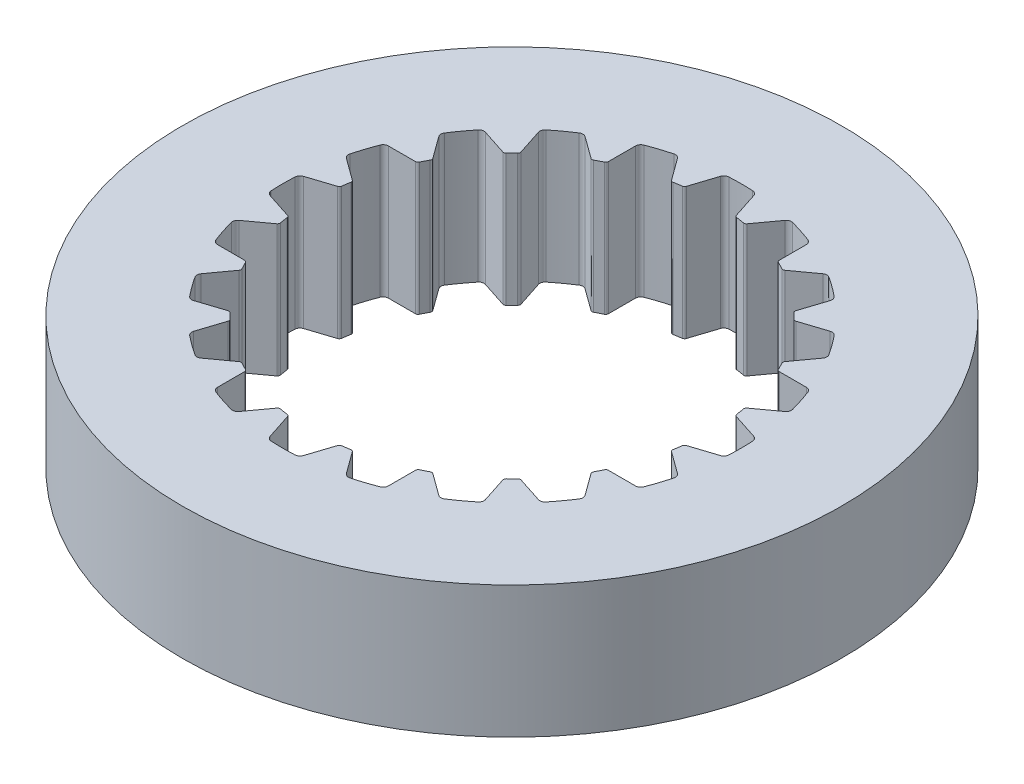
from build123d import *

# Parameters (mm, degrees)
SKETCH1_R                = 15.875
SKETCH1_R_2              = 11.0363
SKETCH1_R_3              = 9.60755
BOSS_EXTRUDE2_DEPTH      = 6.35
SKETCH1_4_R              = 9.60755
CUT_EXTRUDE3_DEPTH       = 6.35
FILLET1_R                = 0.254
CIRPATTERN1_COUNT        = 20
FILLET1_OF_CIRPATTERN1_R = 0.254
FILLET2_R                = 0.127
CIRPATTERN3_DEPTH        = 6.35


# Read off the part's stored shape, not the designer's step: CirPattern3
with BuildPart() as part:
    # Sketch1 → Boss-Extrude2 (new body)
    # profile 1 of 6: a face of its own
    with BuildSketch(Plane(origin=(0, 0, 0), x_dir=(1, 0, 0), z_dir=(0, 1, 0))):
        with Locations(Location((0, 0, 0), (0, 0, 270))):
            Circle(SKETCH1_R)
        Circle(SKETCH1_R_2, mode=Mode.SUBTRACT)
    # profile 2 of 6: a face of its own
    with BuildSketch(Plane(origin=(0, 0, 0), x_dir=(1, 0, 0), z_dir=(0, 1, 0))):
        with BuildLine():
            ThreePointArc((9.60755, 0), (-6.343085848, -7.215973872), (-1.2319, 9.528244297))
            Line((-1.2319, 9.528244297), (-1.043754312, 10.106244453))
            Line((-1.043754312, 10.106244453), (-0.7493, 11.010834083))
            ThreePointArc((-0.7493, 11.010834083), (-7.534268979, -8.064409999), (11.0363, 0))
            ThreePointArc((11.0363, 0), (8.064409999, 7.534268979), (0.7493, 11.010834083))
            Line((0.7493, 11.010834083), (1.043754312, 10.106244453))
            Line((1.043754312, 10.106244453), (1.2319, 9.528244297))
            ThreePointArc((1.2319, 9.528244297), (7.215973872, 6.343085848), (9.60755, 0))
        make_face()
    # profile 3 of 6: a face of its own
    with BuildSketch(Plane(origin=(0, 0, 0), x_dir=(1, 0, 0), z_dir=(0, 1, 0))):
        Circle(SKETCH1_R_3)
    # profile 4 of 6: a face of its own
    with BuildSketch(Plane(origin=(0, 0, 0), x_dir=(1, 0, 0), z_dir=(0, 1, 0))):
        with BuildLine():
            Line((-1.043754312, 10.106244453), (-1.2319, 9.528244297))
            ThreePointArc((-1.2319, 9.528244297), (0, 9.60755), (1.2319, 9.528244297))
            Line((1.2319, 9.528244297), (1.043754312, 10.106244453))
            Line((1.043754312, 10.106244453), (0.7366, 11.011690975))
            ThreePointArc((0.7366, 11.011690975), (0, 11.0363), (-0.7366, 11.011690975))
            Line((-0.7366, 11.011690975), (-1.043754312, 10.106244453))
        make_face()
    # profile 5 of 6: a face of its own
    with BuildSketch(Plane(origin=(0, 0, 0), x_dir=(1, 0, 0), z_dir=(0, 1, 0))):
        with BuildLine():
            Line((0.7366, 11.011690975), (1.043754312, 10.106244453))
            Line((1.043754312, 10.106244453), (0.7493, 11.010834083))
            ThreePointArc((0.7493, 11.010834083), (0.742950124, 11.01126436), (0.7366, 11.011690975))
        make_face()
    # profile 6 of 6: a face of its own
    with BuildSketch(Plane(origin=(0, 0, 0), x_dir=(1, 0, 0), z_dir=(0, 1, 0))):
        with BuildLine():
            Line((-0.7493, 11.010834083), (-1.043754312, 10.106244453))
            Line((-1.043754312, 10.106244453), (-0.7366, 11.011690975))
            ThreePointArc((-0.7366, 11.011690975), (-0.742950124, 11.01126436), (-0.7493, 11.010834083))
        make_face()
    extrude(amount=BOSS_EXTRUDE2_DEPTH)

    # Sketch1<4> → Cut-Extrude3 (cut)
    with BuildSketch(Plane(origin=(0, 0, 0), x_dir=(1, 0, 0), z_dir=(0, 1, 0))):
        Circle(SKETCH1_4_R)
        with BuildLine():
            Line((-0.7493, 11.010834083), (-1.2319, 9.528244297))
            ThreePointArc((-1.2319, 9.528244297), (0, 9.60755), (1.2319, 9.528244297))
            Line((1.2319, 9.528244297), (0.7493, 11.010834083))
            ThreePointArc((0.7493, 11.010834083), (0, 11.0363), (-0.7493, 11.010834083))
        make_face()
    cut_extrude3 = extrude(amount=CUT_EXTRUDE3_DEPTH, mode=Mode.SUBTRACT)

    # Fillet1
    fillet1_edges = [part.edges().sort_by_distance(p)[0] for p in [
        (0.7493, 3.175, -11.010834083),
        (-0.7493, 3.175, -11.010834083),
    ]]
    fillet(fillet1_edges, radius=FILLET1_R)

    # CirPattern1: Cut-Extrude3 ×20 about axis
    cirpattern1_axis = Axis((0, 0, 0), (0, 1, 0))
    for i in range(1, CIRPATTERN1_COUNT):
        add(cut_extrude3.rotate(cirpattern1_axis, i * 360 / CIRPATTERN1_COUNT), mode=Mode.SUBTRACT)

    # Fillet1 of CirPattern1
    fillet1_of_cirpattern1_edges = [part.edges().sort_by_distance(p)[0] for p in [
        (-2.689908206, 3.175, -10.703471938),
        (-4.115161502, 3.175, -10.24037907),
        (-5.865809455, 3.175, -9.348379385),
        (-7.078202323, 3.175, -8.467524406),
        (-8.467524406, 3.175, -7.078202323),
        (-9.348379385, 3.175, -5.865809455),
        (-10.24037907, 3.175, -4.115161502),
        (-10.703471938, 3.175, -2.689908206),
        (-11.010834083, 3.175, -0.7493),
        (-11.010834083, 3.175, 0.7493),
        (-10.703471938, 3.175, 2.689908206),
        (-10.24037907, 3.175, 4.115161502),
        (-9.348379385, 3.175, 5.865809455),
        (-8.467524406, 3.175, 7.078202323),
        (-7.078202323, 3.175, 8.467524406),
        (-5.865809455, 3.175, 9.348379385),
        (-4.115161502, 3.175, 10.24037907),
        (-2.689908206, 3.175, 10.703471938),
        (-0.7493, 3.175, 11.010834083),
        (0.7493, 3.175, 11.010834083),
        (2.689908206, 3.175, 10.703471938),
        (4.115161502, 3.175, 10.24037907),
        (5.865809455, 3.175, 9.348379385),
        (7.078202323, 3.175, 8.467524406),
        (8.467524406, 3.175, 7.078202323),
        (9.348379385, 3.175, 5.865809455),
        (10.24037907, 3.175, 4.115161502),
        (10.703471938, 3.175, 2.689908206),
        (11.010834083, 3.175, 0.7493),
        (11.010834083, 3.175, -0.7493),
        (10.703471938, 3.175, -2.689908206),
        (10.24037907, 3.175, -4.115161502),
        (9.348379385, 3.175, -5.865809455),
        (8.467524406, 3.175, -7.078202323),
        (7.078202323, 3.175, -8.467524406),
        (5.865809455, 3.175, -9.348379385),
        (4.115161502, 3.175, -10.24037907),
        (2.689908206, 3.175, -10.703471938),
    ]]
    fillet(fillet1_of_cirpattern1_edges, radius=FILLET1_OF_CIRPATTERN1_R)

    # Fillet2
    fillet2_edges = [part.edges().sort_by_distance(p)[0] for p in [
        (-1.772782892, 3.175, -9.442576863),
        (-1.2319, 3.175, -9.528244297),
    ]]
    fillet(fillet2_edges, radius=FILLET2_R)

    # CirPattern3 outline → CirPattern3 (cut)
    with BuildSketch(Plane(origin=(0, 0, 0), x_dir=(1, 0, 0), z_dir=(0, 1, 0))):
        with BuildLine():
            ThreePointArc((4.115995937, 8.681220793), (4.151832536, 8.664138942), (4.187598245, 8.646909155))
            ThreePointArc((4.187598245, 8.646909155), (4.135362945, 8.693732158), (4.115953164, 8.761142696))
            Line((4.115953164, 8.761142696), (4.115995937, 8.681220793))
        make_face()
        with BuildLine():
            ThreePointArc((4.668616762, 8.479546528), (4.602671709, 8.455626451), (4.534087965, 8.470363825))
            ThreePointArc((4.534087965, 8.470363825), (4.569049711, 8.451556173), (4.603933443, 8.432604216))
            Line((4.603933443, 8.432604216), (4.668616762, 8.479546528))
        make_face()
        with BuildLine():
            ThreePointArc((-4.603933443, 8.432604216), (-4.569049711, 8.451556173), (-4.534087965, 8.470363825))
            ThreePointArc((-4.534087965, 8.470363825), (-4.602671709, 8.455626451), (-4.668616762, 8.479546528))
            Line((-4.668616762, 8.479546528), (-4.603933443, 8.432604216))
        make_face()
        with BuildLine():
            ThreePointArc((-4.115953164, 8.761142696), (-4.135362945, 8.693732158), (-4.187598245, 8.646909155))
            ThreePointArc((-4.187598245, 8.646909155), (-4.151832536, 8.664138942), (-4.115995937, 8.681220793))
            Line((-4.115995937, 8.681220793), (-4.115953164, 8.761142696))
        make_face()
        with BuildLine():
            ThreePointArc((-1.2319, -9.528244297), (-1.271261214, -9.523072609), (-1.310600721, -9.517738321))
            ThreePointArc((-1.310600721, -9.517738321), (-1.246452895, -9.546128048), (-1.207162094, -9.604241327))
            Line((-1.207162094, -9.604241327), (-1.2319, -9.528244297))
        make_face()
        with BuildLine():
            ThreePointArc((-1.819794412, -9.5072099), (-1.76446865, -9.464082413), (-1.694687534, -9.456904946))
            ThreePointArc((-1.694687534, -9.456904946), (-1.733750014, -9.44982158), (-1.772782892, -9.442576863))
            Line((-1.772782892, -9.442576863), (-1.819794412, -9.5072099))
        make_face()
        with BuildLine():
            ThreePointArc((-4.115995937, -8.681220793), (-4.151832536, -8.664138942), (-4.187598245, -8.646909155))
            ThreePointArc((-4.187598245, -8.646909155), (-4.135362945, -8.693732158), (-4.115953164, -8.761142696))
            Line((-4.115953164, -8.761142696), (-4.115995937, -8.681220793))
        make_face()
        with BuildLine():
            ThreePointArc((-4.668616762, -8.479546528), (-4.602671709, -8.455626451), (-4.534087965, -8.470363825))
            ThreePointArc((-4.534087965, -8.470363825), (-4.569049711, -8.451556173), (-4.603933443, -8.432604216))
            Line((-4.603933443, -8.432604216), (-4.668616762, -8.479546528))
        make_face()
        with BuildLine():
            ThreePointArc((-8.432604216, -4.603933443), (-8.451556173, -4.569049711), (-8.470363825, -4.534087965))
            ThreePointArc((-8.470363825, -4.534087965), (-8.455626451, -4.602671709), (-8.479546528, -4.668616762))
            Line((-8.479546528, -4.668616762), (-8.432604216, -4.603933443))
        make_face()
        with BuildLine():
            ThreePointArc((-8.761142696, -4.115953164), (-8.693732158, -4.135362945), (-8.646909155, -4.187598245))
            ThreePointArc((-8.646909155, -4.187598245), (-8.664138942, -4.151832536), (-8.681220793, -4.115995937))
            Line((-8.681220793, -4.115995937), (-8.761142696, -4.115953164))
        make_face()
        with BuildLine():
            ThreePointArc((-6.597189514, -6.984418911), (-6.625993563, -6.957098987), (-6.654684476, -6.929660275))
            ThreePointArc((-6.654684476, -6.929660275), (-6.619474858, -6.990333193), (-6.621846061, -7.060442376))
            Line((-6.621846061, -7.060442376), (-6.597189514, -6.984418911))
        make_face()
        with BuildLine():
            ThreePointArc((-7.060442376, -6.621846061), (-6.990333193, -6.619474858), (-6.929660275, -6.654684476))
            ThreePointArc((-6.929660275, -6.654684476), (-6.957098987, -6.625993563), (-6.984418911, -6.597189514))
            Line((-6.984418911, -6.597189514), (-7.060442376, -6.621846061))
        make_face()
        with BuildLine():
            ThreePointArc((-8.681220793, 4.115995937), (-8.664138942, 4.151832536), (-8.646909155, 4.187598245))
            ThreePointArc((-8.646909155, 4.187598245), (-8.693732158, 4.135362945), (-8.761142696, 4.115953164))
            Line((-8.761142696, 4.115953164), (-8.681220793, 4.115995937))
        make_face()
        with BuildLine():
            ThreePointArc((-8.479546528, 4.668616762), (-8.455626451, 4.602671709), (-8.470363825, 4.534087965))
            ThreePointArc((-8.470363825, 4.534087965), (-8.451556173, 4.569049711), (-8.432604216, 4.603933443))
            Line((-8.432604216, 4.603933443), (-8.479546528, 4.668616762))
        make_face()
        with BuildLine():
            ThreePointArc((-6.984418911, 6.597189514), (-6.957098987, 6.625993563), (-6.929660275, 6.654684476))
            ThreePointArc((-6.929660275, 6.654684476), (-6.990333193, 6.619474858), (-7.060442376, 6.621846061))
            Line((-7.060442376, 6.621846061), (-6.984418911, 6.597189514))
        make_face()
        with BuildLine():
            ThreePointArc((-6.621846061, 7.060442376), (-6.619474858, 6.990333193), (-6.654684476, 6.929660275))
            ThreePointArc((-6.654684476, 6.929660275), (-6.625993563, 6.957098987), (-6.597189514, 6.984418911))
            Line((-6.597189514, 6.984418911), (-6.621846061, 7.060442376))
        make_face()
        with BuildLine():
            ThreePointArc((-9.528244297, 1.2319), (-9.523072609, 1.271261214), (-9.517738321, 1.310600721))
            ThreePointArc((-9.517738321, 1.310600721), (-9.546128048, 1.246452895), (-9.604241327, 1.207162094))
            Line((-9.604241327, 1.207162094), (-9.528244297, 1.2319))
        make_face()
        with BuildLine():
            ThreePointArc((-9.5072099, 1.819794412), (-9.464082413, 1.76446865), (-9.456904946, 1.694687534))
            ThreePointArc((-9.456904946, 1.694687534), (-9.44982158, 1.733750014), (-9.442576863, 1.772782892))
            Line((-9.442576863, 1.772782892), (-9.5072099, 1.819794412))
        make_face()
        with BuildLine():
            ThreePointArc((-9.442576863, -1.772782892), (-9.44982158, -1.733750014), (-9.456904946, -1.694687534))
            ThreePointArc((-9.456904946, -1.694687534), (-9.464082413, -1.76446865), (-9.5072099, -1.819794412))
            Line((-9.5072099, -1.819794412), (-9.442576863, -1.772782892))
        make_face()
        with BuildLine():
            ThreePointArc((-9.604241327, -1.207162094), (-9.546128048, -1.246452895), (-9.517738321, -1.310600721))
            ThreePointArc((-9.517738321, -1.310600721), (-9.523072609, -1.271261214), (-9.528244297, -1.2319))
            Line((-9.528244297, -1.2319), (-9.604241327, -1.207162094))
        make_face()
        with BuildLine():
            ThreePointArc((8.681220793, -4.115995937), (8.664138942, -4.151832536), (8.646909155, -4.187598245))
            ThreePointArc((8.646909155, -4.187598245), (8.693732158, -4.135362945), (8.761142696, -4.115953164))
            Line((8.761142696, -4.115953164), (8.681220793, -4.115995937))
        make_face()
        with BuildLine():
            ThreePointArc((8.479546528, -4.668616762), (8.455626451, -4.602671709), (8.470363825, -4.534087965))
            ThreePointArc((8.470363825, -4.534087965), (8.451556173, -4.569049711), (8.432604216, -4.603933443))
            Line((8.432604216, -4.603933443), (8.479546528, -4.668616762))
        make_face()
        with BuildLine():
            ThreePointArc((6.984418911, -6.597189514), (6.957098987, -6.625993563), (6.929660275, -6.654684476))
            ThreePointArc((6.929660275, -6.654684476), (6.990333193, -6.619474858), (7.060442376, -6.621846061))
            Line((7.060442376, -6.621846061), (6.984418911, -6.597189514))
        make_face()
        with BuildLine():
            ThreePointArc((6.621846061, -7.060442376), (6.619474858, -6.990333193), (6.654684476, -6.929660275))
            ThreePointArc((6.654684476, -6.929660275), (6.625993563, -6.957098987), (6.597189514, -6.984418911))
            Line((6.597189514, -6.984418911), (6.621846061, -7.060442376))
        make_face()
        with BuildLine():
            ThreePointArc((1.772782892, -9.442576863), (1.733750014, -9.44982158), (1.694687534, -9.456904946))
            ThreePointArc((1.694687534, -9.456904946), (1.76446865, -9.464082413), (1.819794412, -9.5072099))
            Line((1.819794412, -9.5072099), (1.772782892, -9.442576863))
        make_face()
        with BuildLine():
            ThreePointArc((1.207162094, -9.604241327), (1.246452895, -9.546128048), (1.310600721, -9.517738321))
            ThreePointArc((1.310600721, -9.517738321), (1.271261214, -9.523072609), (1.2319, -9.528244297))
            Line((1.2319, -9.528244297), (1.207162094, -9.604241327))
        make_face()
        with BuildLine():
            ThreePointArc((4.603933443, -8.432604216), (4.569049711, -8.451556173), (4.534087965, -8.470363825))
            ThreePointArc((4.534087965, -8.470363825), (4.602671709, -8.455626451), (4.668616762, -8.479546528))
            Line((4.668616762, -8.479546528), (4.603933443, -8.432604216))
        make_face()
        with BuildLine():
            ThreePointArc((4.115953164, -8.761142696), (4.135362945, -8.693732158), (4.187598245, -8.646909155))
            ThreePointArc((4.187598245, -8.646909155), (4.151832536, -8.664138942), (4.115995937, -8.681220793))
            Line((4.115995937, -8.681220793), (4.115953164, -8.761142696))
        make_face()
        with BuildLine():
            ThreePointArc((9.442576863, 1.772782892), (9.44982158, 1.733750014), (9.456904946, 1.694687534))
            ThreePointArc((9.456904946, 1.694687534), (9.464082413, 1.76446865), (9.5072099, 1.819794412))
            Line((9.5072099, 1.819794412), (9.442576863, 1.772782892))
        make_face()
        with BuildLine():
            ThreePointArc((9.604241327, 1.207162094), (9.546128048, 1.246452895), (9.517738321, 1.310600721))
            ThreePointArc((9.517738321, 1.310600721), (9.523072609, 1.271261214), (9.528244297, 1.2319))
            Line((9.528244297, 1.2319), (9.604241327, 1.207162094))
        make_face()
        with BuildLine():
            ThreePointArc((9.528244297, -1.2319), (9.523072609, -1.271261214), (9.517738321, -1.310600721))
            ThreePointArc((9.517738321, -1.310600721), (9.546128048, -1.246452895), (9.604241327, -1.207162094))
            Line((9.604241327, -1.207162094), (9.528244297, -1.2319))
        make_face()
        with BuildLine():
            ThreePointArc((9.5072099, -1.819794412), (9.464082413, -1.76446865), (9.456904946, -1.694687534))
            ThreePointArc((9.456904946, -1.694687534), (9.44982158, -1.733750014), (9.442576863, -1.772782892))
            Line((9.442576863, -1.772782892), (9.5072099, -1.819794412))
        make_face()
        with BuildLine():
            ThreePointArc((8.432604216, 4.603933443), (8.451556173, 4.569049711), (8.470363825, 4.534087965))
            ThreePointArc((8.470363825, 4.534087965), (8.455626451, 4.602671709), (8.479546528, 4.668616762))
            Line((8.479546528, 4.668616762), (8.432604216, 4.603933443))
        make_face()
        with BuildLine():
            ThreePointArc((8.761142696, 4.115953164), (8.693732158, 4.135362945), (8.646909155, 4.187598245))
            ThreePointArc((8.646909155, 4.187598245), (8.664138942, 4.151832536), (8.681220793, 4.115995937))
            Line((8.681220793, 4.115995937), (8.761142696, 4.115953164))
        make_face()
        with BuildLine():
            ThreePointArc((6.597189514, 6.984418911), (6.625993563, 6.957098987), (6.654684476, 6.929660275))
            ThreePointArc((6.654684476, 6.929660275), (6.619474858, 6.990333193), (6.621846061, 7.060442376))
            Line((6.621846061, 7.060442376), (6.597189514, 6.984418911))
        make_face()
        with BuildLine():
            ThreePointArc((7.060442376, 6.621846061), (6.990333193, 6.619474858), (6.929660275, 6.654684476))
            ThreePointArc((6.929660275, 6.654684476), (6.957098987, 6.625993563), (6.984418911, 6.597189514))
            Line((6.984418911, 6.597189514), (7.060442376, 6.621846061))
        make_face()
        with BuildLine():
            ThreePointArc((1.2319, 9.528244297), (1.271261214, 9.523072609), (1.310600721, 9.517738321))
            ThreePointArc((1.310600721, 9.517738321), (1.246452895, 9.546128048), (1.207162094, 9.604241327))
            Line((1.207162094, 9.604241327), (1.2319, 9.528244297))
        make_face()
        with BuildLine():
            ThreePointArc((1.819794412, 9.5072099), (1.76446865, 9.464082413), (1.694687534, 9.456904946))
            ThreePointArc((1.694687534, 9.456904946), (1.733750014, 9.44982158), (1.772782892, 9.442576863))
            Line((1.772782892, 9.442576863), (1.819794412, 9.5072099))
        make_face()
    extrude(amount=CIRPATTERN3_DEPTH, mode=Mode.SUBTRACT)


solid = part.part
